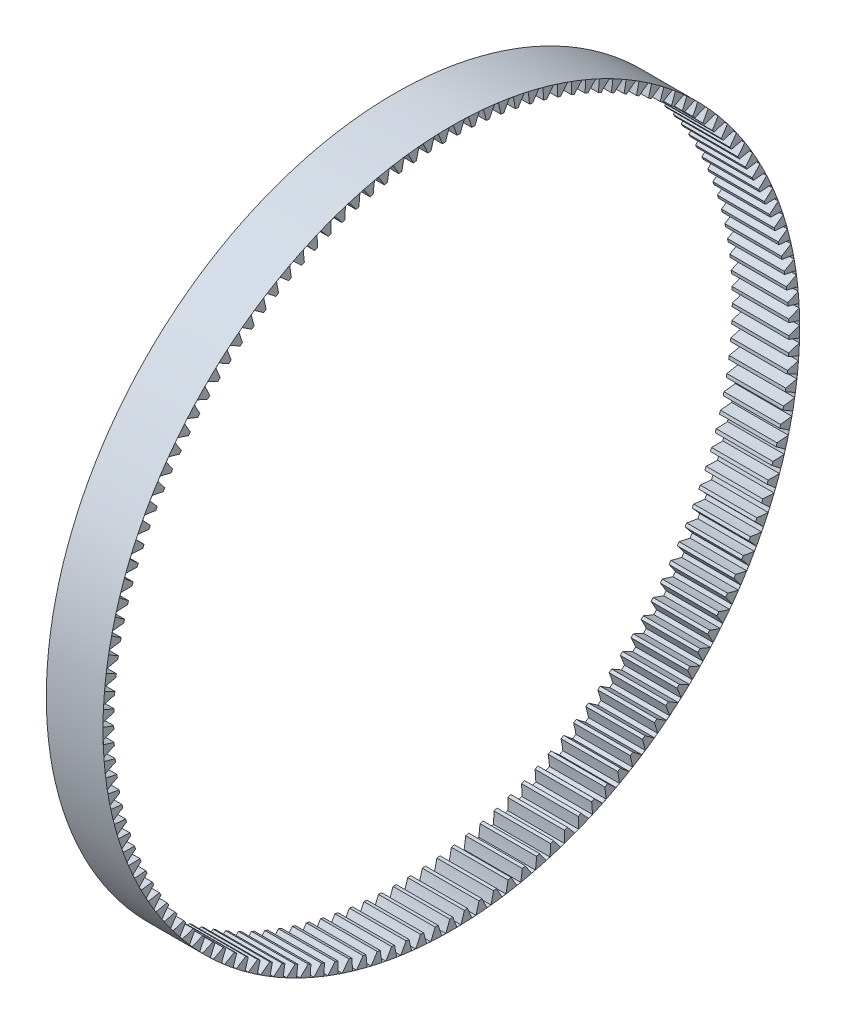
from build123d import *

# Parameters (mm, degrees)
BASPROSKE_W     = 12
BASPROSKE_H     = 2.2764
TOOTHCUT_DEPTH  = 106.023399269
TEETHCUTS_COUNT = 145
TEETHCUTS_ANGLE = 357.517241379


with BuildPart() as part:
    # BasProSke → Base-Revolve (revolve)
    with BuildSketch(Plane(origin=(0, 0, 0), x_dir=(1, 0, 0), z_dir=(0, 1, 0))):
        with Locations((6, 72.6382)):
            Rectangle(BASPROSKE_W, BASPROSKE_H)
    revolve(axis=Axis((-10, 0, 0), (1, 0, 0)))

    # TooCutSke → ToothCut (cut, through all)
    with BuildSketch(Plane(origin=(0, 0, 0), x_dir=(0, 0, -1), z_dir=(1, 0, 0))):
        with BuildLine():
            ThreePointArc((1.220920859, 71.464171425), (0.83882496, 72.613696183), (0.418534146, 73.749812408))
            ThreePointArc((0.418534146, 73.749812408), (0, 73.751), (-0.418534146, 73.749812408))
            ThreePointArc((-0.418534146, 73.749812408), (-0.83882496, 72.613696183), (-1.220920859, 71.464171425))
            ThreePointArc((-1.220920859, 71.464171425), (0, 71.4746), (1.220920859, 71.464171425))
        make_face()
    toothcut = extrude(amount=TOOTHCUT_DEPTH, mode=Mode.SUBTRACT)

    # TeethCuts: ToothCut ×145 about axis
    teethcuts_axis = Axis((-10, 0, 0), (1, 0, 0))
    for i in range(1, TEETHCUTS_COUNT):
        add(toothcut.rotate(teethcuts_axis, i * TEETHCUTS_ANGLE / (TEETHCUTS_COUNT - 1)), mode=Mode.SUBTRACT)


solid = part.part
